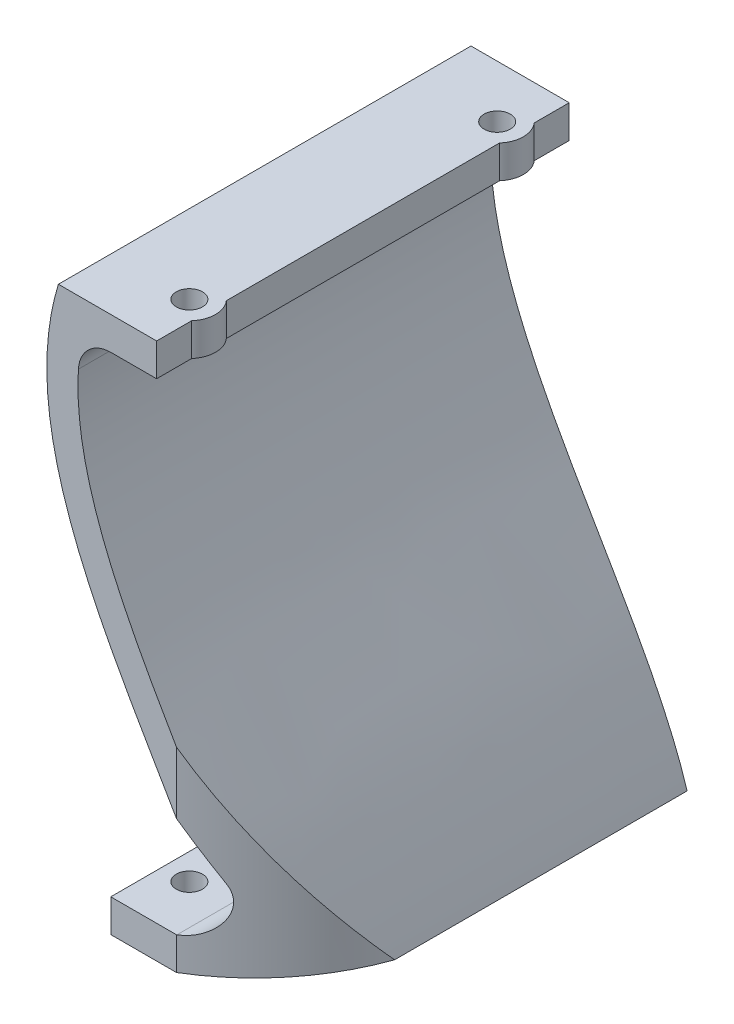
from build123d import *

# Parameters (mm, degrees)
BOSS_EXTRUDE1_DEPTH = 63
CUT_EXTRUDE4_DEPTH  = 60
BOSS_EXTRUDE5_DEPTH = 5
FILLET3_R           = 5
BOSS_EXTRUDE6_DEPTH = 5
BOSS_EXTRUDE7_DEPTH = 63
FILLET4_R           = 5
SKETCH14_R          = 1.9999999999999996
SKETCH14_R_2        = 2
CUT_EXTRUDE5_DEPTH  = 10
SKETCH15_R          = 4.000000000000002
SKETCH15_R_2        = 2
SKETCH15_R_3        = 4.000000000000001
SKETCH15_R_4        = 1.9999999999999996
BOSS_EXTRUDE8_DEPTH = 5
CUT_EXTRUDE6_START  = -5
SKETCH16_R          = 2
SKETCH16_R_2        = 1.9999999999999996
CUT_EXTRUDE6_DEPTH  = 5


# Read off the part's stored shape, not the designer's step: Boss-Extrude1
with BuildPart() as part:
    # Boss-Extrude1 outline → Boss-Extrude1 (new body)
    with BuildSketch(Plane.XY):
        with BuildLine():
            Line((4.954113003, -60.810475982), (9.954113003, -60.810475982))
            add(Edge.make_bspline(
                [(9.954113003, -60.810475982), (1.78782004145555, -34.5665002552168), (-27.9913048539535, -7.28206006884536), (-18.045886997, 21.189524018)],
                knots=[0, 0, 0, 0, 1, 1, 1, 1], degree=3))
            Line((-18.045886997, 21.189524018), (-23.045886997, 21.189524018))
            add(Edge.make_bspline(
                [(-23.045886997, 21.189524018), (-23.192896954450642, 20.707388183877445), (-23.619107908159766, 19.212032019757164), (-24.3984566732412, 15.7227335791878), (-24.9259424602794, 10.7154717202631), (-24.7059244457818, 4.80639957244901), (-23.4437954980132, -2.90791828688786), (-20.3649701079, -12.2138739410152), (-15.1627192062184, -22.9267758821705), (-9.22446854976525, -33.2839412268649), (-4.2731817504284, -41.6523064711653), (-0.670405229165687, -48.1782991582584), (1.76514247549924, -52.980809675903), (3.49961876568494, -56.8892897902748), (4.492016037450547, -59.4867262662843), (4.856824135774904, -60.5259563871115), (4.954113003, -60.810475982)],
                knots=[0.01630237867055594, 0.01630237867055594, 0.01630237867055594, 0.01630237867055594, 0.03125, 0.0625, 0.125, 0.1875, 0.25, 0.375, 0.5, 0.625, 0.75, 0.8125, 0.875, 0.9375, 0.96875, 0.9805431413660037, 0.9805431413660037, 0.9805431413660037, 0.9805431413660037], degree=3))
        make_face()
    extrude(amount=BOSS_EXTRUDE1_DEPTH)

    # Sketch10 → Cut-Extrude4 (cut)
    with BuildSketch(Plane.XZ.offset(60.81047598214444)):
        with BuildLine():
            Line((9.954113003304059, 63), (9.954113003304059, 44.66190378968828))
            ThreePointArc((9.954113003304059, 44.66190378968828), (4.065539070195477, 55.13527900478137), (-5.018130619372688, 63))
            Line((-5.018130619372688, 63), (4.954113003304057, 63))
            Line((4.954113003304057, 63), (9.954113003304059, 63))
        make_face()
    extrude(amount=-CUT_EXTRUDE4_DEPTH, mode=Mode.SUBTRACT)

    # Sketch11 → Boss-Extrude5 (add)
    with BuildSketch(Plane.XZ.offset(60.81047598214444)):
        with BuildLine():
            Line((-15.045886996695936, 6e-16), (4.954113003304057, 0))
            Line((4.954113003304057, 0), (4.954113003304058, 54.00000000000057))
            ThreePointArc((4.954113003304058, 54.00000000000057), (0.4038163976446967, 58.98290612532635), (-5.018130619372695, 63))
            Line((-5.018130619372695, 63), (-15.045886996695936, 63))
            Line((-15.045886996695936, 63), (-15.045886996695936, 6e-16))
        make_face()
    extrude(amount=-BOSS_EXTRUDE5_DEPTH)

    # Fillet3
    fillet3_edges = [part.edges().sort_by_distance(p)[0] for p in [
        (3.003762593217399, -55.81047598214444, 28.187768789799662),
    ]]
    fillet(fillet3_edges, radius=FILLET3_R)



with BuildPart() as body_2:
    # Sketch12 → Boss-Extrude6 (new body)
    with BuildSketch(Plane(origin=(0, 21.189524017855575, 0), x_dir=(1, 0, 0), z_dir=(0, 1, 0))):
        Polygon((-18.04588699669594, -63), (-18.04588699669594, 0), (-8.045886996695941, -3.31e-15), (-8.045886996695941, -63), align=None)
    extrude(amount=-BOSS_EXTRUDE6_DEPTH)


with BuildPart() as part_1:
    add(part.part)

    add(body_2.part)  # Boss-Extrude7 merges body 2
    # Sketch13 → Boss-Extrude7 (add)
    with BuildSketch(Plane.XY.offset(63)):
        with BuildLine():
            Line((-18.04588699669594, 16.189524017855575), (-18.04588699669594, 21.189524017855575))
            add(Edge.make_bspline(
                [(-19.398734896011995, 16.18952401785558), (-19.076313221090718, 17.852122543862073), (-18.62949534090365, 19.51877933077492), (-18.04588699669594, 21.189524017855575)],
                knots=[0.9413188714055053, 0.9413188714055053, 0.9413188714055053, 0.9413188714055053, 1, 1, 1, 1], degree=3))
            Line((-19.398734896011995, 16.18952401785558), (-18.04588699669594, 16.189524017855575))
        make_face()
    extrude(amount=-BOSS_EXTRUDE7_DEPTH)

    # Fillet4
    fillet4_edges = [part_1.edges().sort_by_distance(p)[0] for p in [
        (-19.398734896011995, 16.18952401785558, 31.5),
    ]]
    fillet(fillet4_edges, radius=FILLET4_R)

    # Sketch14 → Cut-Extrude5 (cut)
    with BuildSketch(Plane.XZ.offset(-16.18952401785553)):
        with Locations((-11.045886996695984, 8)):
            Circle(SKETCH14_R)
        with Locations((-11.045886996695984, 55)):
            Circle(SKETCH14_R_2)
    extrude(amount=-CUT_EXTRUDE5_DEPTH, mode=Mode.SUBTRACT)

    # Sketch15 → Boss-Extrude8 (add)
    # profile 1 of 2: a face of its own
    with BuildSketch(Plane.XZ.offset(-16.18952401785553)):
        with Locations((-11.045886996695982, 55)):
            Circle(SKETCH15_R)
        with Locations((-11.045886996695982, 55)):
            Circle(SKETCH15_R_2, mode=Mode.SUBTRACT)
    # profile 2 of 2: a face of its own
    with BuildSketch(Plane.XZ.offset(-16.18952401785553)):
        with Locations((-11.045886996695982, 8)):
            Circle(SKETCH15_R_3)
        with Locations((-11.045886996695982, 8)):
            Circle(SKETCH15_R_4, mode=Mode.SUBTRACT)
    extrude(amount=-BOSS_EXTRUDE8_DEPTH)

    # Sketch16 → Cut-Extrude6 (cut)
    with BuildSketch(Plane(origin=(0, -55.81047598214444, 0), x_dir=(1, 0, 0), z_dir=(0, 1, 0)).offset(CUT_EXTRUDE6_START)):
        with Locations((-11.045886996695936, -55)):
            Circle(SKETCH16_R)
        with Locations((-11.045886996695936, -8)):
            Circle(SKETCH16_R_2)
    extrude(amount=CUT_EXTRUDE6_DEPTH, mode=Mode.SUBTRACT)


solid = part_1.part
